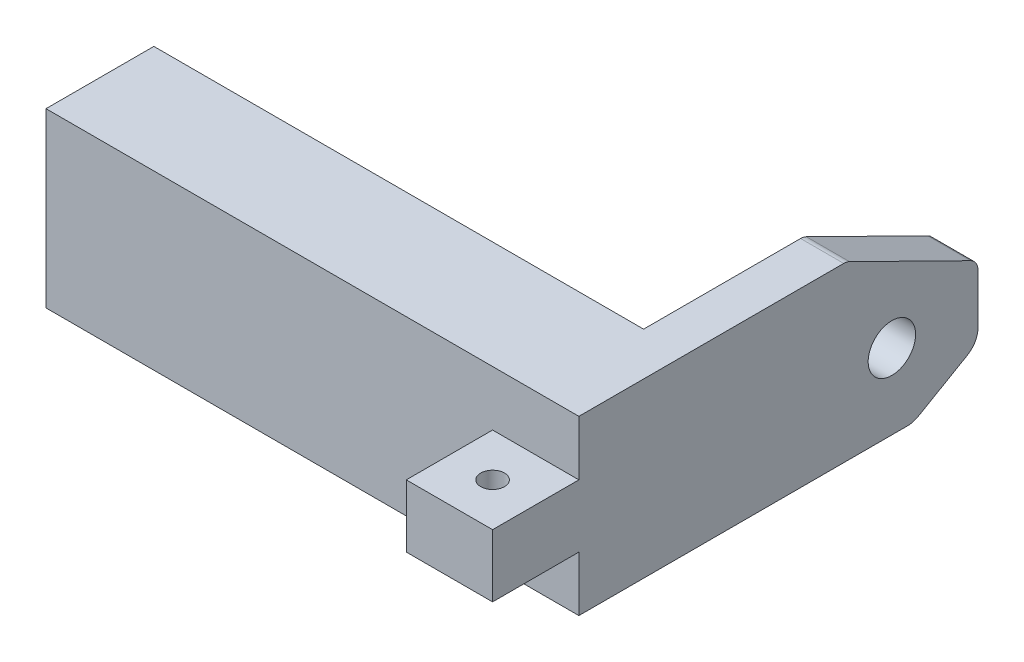
from build123d import *

# Parameters (mm, degrees)
SKETCH1_W            = 92.5
SKETCH1_H            = 40
BOSS_EXTRUDE1_DEPTH  = 10
SKETCH5_R            = 5.5
CUT_EXTRUDE1_DEPTH   = 27
SKETCH4_W            = 25
SKETCH4_H            = 40
SKETCH4_W_2          = 10.25
SKETCH4_H_2          = 25.25
BOSS_EXTRUDE7_DEPTH  = 113.5
FILLET1_R            = 3
CHAMFER1_SIZE        = 15
CHAMFER1_SIZE2       = 30.41699103
FILLET3_R            = 3
CHAMFER3_SIZE        = 15
CHAMFER3_SIZE2       = 8.660254038
FILLET7_R            = 5
SKETCH7_W            = 20
SKETCH7_H            = 14.5
BOSS_EXTRUDE8_DEPTH  = 20
M5_CLEARANCE_HOLE1_D = 5.5


with BuildPart() as part:
    # Sketch1 → Boss-Extrude1 (new body)
    with BuildSketch(Plane(origin=(0, 0, 0), x_dir=(0, 0, -1), z_dir=(1, 0, 0))):
        with Locations((10.335365854, 0.129573171)):
            Rectangle(SKETCH1_W, SKETCH1_H)
    extrude(amount=BOSS_EXTRUDE1_DEPTH)

    # Sketch5 → Cut-Extrude1 (cut)
    with BuildSketch(Plane.ZY):
        with Locations((-36.625365854, -2.430426829)):
            Circle(SKETCH5_R)
    extrude(amount=-CUT_EXTRUDE1_DEPTH, mode=Mode.SUBTRACT)

    # Sketch4 → Boss-Extrude7 (add)
    with BuildSketch(Plane.ZY):
        with Locations((23.414634146, 0.129573171)):
            Rectangle(SKETCH4_W, SKETCH4_H)
        with Locations((23.414634146, 0.129573171)):
            Rectangle(SKETCH4_W_2, SKETCH4_H_2, mode=Mode.SUBTRACT)
    extrude(amount=BOSS_EXTRUDE7_DEPTH)

    # Fillet1
    fillet1_edges = [part.edges().sort_by_distance(p)[0] for p in [
        (-113.5, -12.495426829, 23.414634146),
        (-113.5, 0.129573171, 28.539634146),
        (-113.5, 12.754573171, 23.414634146),
        (-113.5, 0.129573171, 18.289634146),
    ]]
    fillet(fillet1_edges, radius=FILLET1_R)

    # Chamfer1
    chamfer1_edges = [part.edges().sort_by_distance(p)[0] for p in [
        (5, 20.129573171, -56.585365854),
    ]]
    chamfer1_side = [part.faces().sort_by_distance(p)[0] for p in [
        (5, 0.129573171, -56.585365854),
    ]]
    chamfer(chamfer1_edges, length=CHAMFER1_SIZE, length2=CHAMFER1_SIZE2, reference=chamfer1_side[0])

    # Fillet3
    fillet3_edges = [part.edges().sort_by_distance(p)[0] for p in [
        (5, 20.129573171, -26.168374824),
        (5, 5.129573171, -56.585365854),
    ]]
    fillet(fillet3_edges, radius=FILLET3_R)

    # Chamfer3
    chamfer3_edges = [part.edges().sort_by_distance(p)[0] for p in [
        (5, -19.870426829, -56.585365854),
    ]]
    chamfer3_side = [part.faces().sort_by_distance(p)[0] for p in [
        (-41.568936877, -19.870426829, 15.117291954),
    ]]
    chamfer(chamfer3_edges, length=CHAMFER3_SIZE, length2=CHAMFER3_SIZE2, reference=chamfer3_side[0])

    # Fillet7
    fillet7_edges = [part.edges().sort_by_distance(p)[0] for p in [
        (5, -19.870426829, -41.585365854),
        (5, -11.210172791, -56.585365854),
    ]]
    fillet(fillet7_edges, radius=FILLET7_R)

    # Sketch7 → Boss-Extrude8 (add)
    with BuildSketch(Plane(origin=(10, 20.129573171, 35.914634146), x_dir=(1, 0, 0), z_dir=(0, 0, 1))):
        with Locations((-10, -20)):
            Rectangle(SKETCH7_W, SKETCH7_H)
    extrude(amount=BOSS_EXTRUDE8_DEPTH)

    # M5 Clearance Hole1 (through all)
    with Locations(Plane(origin=(0, 7.379573171, 0), x_dir=(1, 0, 0), z_dir=(0, 1, 0))):
        with Locations((0, -45.914634146)):
            Hole(M5_CLEARANCE_HOLE1_D / 2)


solid = part.part
